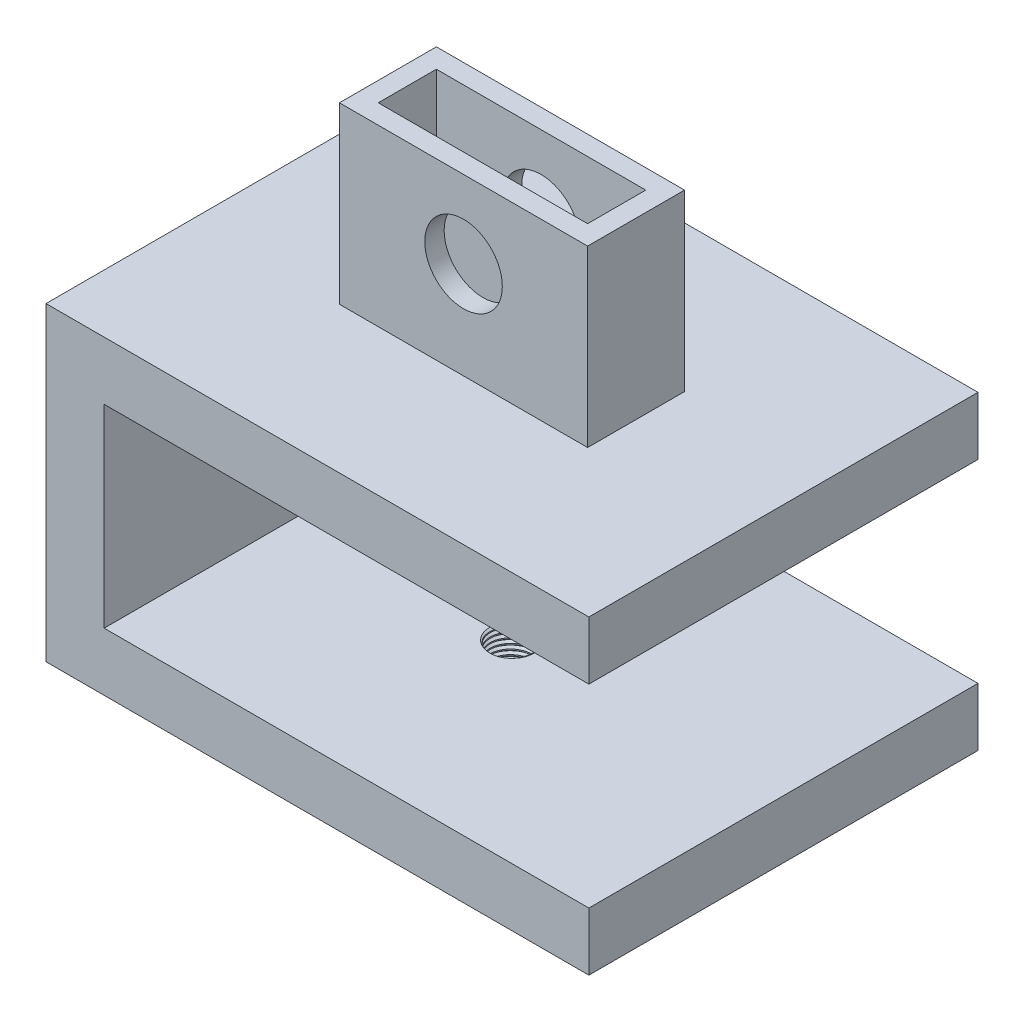
from build123d import *

# Parameters (mm, degrees)
SKETCH1_W               = 140
SKETCH1_H               = 100.352346042
BOSS_EXTRUDE1_DEPTH     = 80
CUT_EXTRUDE1_DEPTH      = 80
CUT_EXTRUDE1_DEPTH_BACK = 80
SKETCH3_R               = 5.45
CUT_EXTRUDE2_DEPTH      = 37
BOSS_EXTRUDE2_START     = 80
SKETCH4_W               = 64
SKETCH4_H               = 25
SKETCH4_W_2             = 54
SKETCH4_H_2             = 15
BOSS_EXTRUDE2_DEPTH     = 45
SKETCH5_R               = 10
CUT_EXTRUDE3_DEPTH      = 37
THREAD1_PITCH           = 1.25


with BuildPart() as part:
    # Sketch1 → Boss-Extrude1 (new body)
    with BuildSketch(Plane(origin=(0, 0, 0), x_dir=(1, 0, 0), z_dir=(0, 1, 0))):
        Rectangle(SKETCH1_W, SKETCH1_H)
    extrude(amount=BOSS_EXTRUDE1_DEPTH)

    # Sketch2 → Cut-Extrude1 (cut, two sides: drawn at the far end of the back side and taken through both)
    with BuildSketch(Plane.XY.offset(-CUT_EXTRUDE1_DEPTH_BACK)):
        Polygon((-43.370244555, 65), (-55, 65), (-55, 15), (70, 15), (70, 65), align=None)
    extrude(amount=CUT_EXTRUDE1_DEPTH + CUT_EXTRUDE1_DEPTH_BACK, mode=Mode.SUBTRACT)

    # Sketch3 → Cut-Extrude2 (cut)
    with BuildSketch(Plane(origin=(0, 0, 0), x_dir=(1, 0, 0), z_dir=(0, 1, 0))):
        with Locations(Location((0, 0, 0), (0, 0, 270))):
            Circle(SKETCH3_R)
    extrude(amount=CUT_EXTRUDE2_DEPTH, mode=Mode.SUBTRACT)

    # Sketch4 → Boss-Extrude2 (add)
    with BuildSketch(Plane(origin=(0, 0, 0), x_dir=(1, 0, 0), z_dir=(0, 1, 0)).offset(BOSS_EXTRUDE2_START)):
        Rectangle(SKETCH4_W, SKETCH4_H)
        Rectangle(SKETCH4_W_2, SKETCH4_H_2, mode=Mode.SUBTRACT)
    extrude(amount=BOSS_EXTRUDE2_DEPTH)

    # Sketch5 → Cut-Extrude3 (cut)
    with BuildSketch(Plane.XY.offset(12.5)):
        with Locations((0, 105)):
            Circle(SKETCH5_R)
    extrude(amount=-CUT_EXTRUDE3_DEPTH, mode=Mode.SUBTRACT)

    # Thread1: arcs per turn and ends read off the stored shape
    # Thread1: the profile of Thread Profile1 profile screwed along a right-hand helix through 72 turns, 6 arcs to a turn; built about Z, then put on its axis
    thread1_z = Axis((0, 0, 0), (0, 0, 1))
    thread1_corners = [(5.4497, 0, -0.000173205), (6.126582344, 0, 0.390624998), (6.126582344, 0, 0.546874998), (5.4497, 0, 0.937673202)]
    with BuildLine(mode=Mode.PRIVATE) as thread1_profile:
        Line(thread1_corners[0], thread1_corners[1])
        Line(thread1_corners[1], thread1_corners[2])
        Line(thread1_corners[2], thread1_corners[3])
        Line(thread1_corners[3], thread1_corners[0])
    thread1_cap = Face(thread1_profile.wire())
    thread1_turn_angles = [0, 30, 60, 90, 120, 150, 180, 210, 240, 270, 300, 330, 360]
    thread1_turn_weights = [1, 0.8660254037844387, 1, 0.8660254037844387, 1, 0.8660254037844387, 1, 0.8660254037844387, 1, 0.8660254037844387, 1, 0.8660254037844387, 1]
    thread1_turn_rails = [Edge.make_bspline([Vector(p[0], p[1], 0).rotate(thread1_z, thread1_turn_angles[k]) / thread1_turn_weights[k] + Vector(0, 0, p[2] + THREAD1_PITCH * thread1_turn_angles[k] / 360) for k in range(13)], [0, 0, 0, 1, 1, 2, 2, 3, 3, 4, 4, 5, 5, 6, 6, 6], 2, thread1_turn_weights) for p in thread1_corners]
    thread1_turn_sides = [Face.make_surface_from_curves(thread1_turn_rails[p[0]], thread1_turn_rails[p[1]]) for p in [(0, 1), (1, 2), (2, 3), (3, 0)]]
    thread1 = Plane(origin=(0, 25, 0), x_dir=(-1, 0, 0), z_dir=(0, -1, 0)) * Solid(Shell([*[p.moved(Location((0, 0, THREAD1_PITCH * i))) for i in range(72) for p in thread1_turn_sides], thread1_cap, thread1_cap.rotate(thread1_z, 25920).moved(Location((0, 0, THREAD1_PITCH * 25920 / 360)))]))
    add(thread1, mode=Mode.SUBTRACT)


solid = part.part
